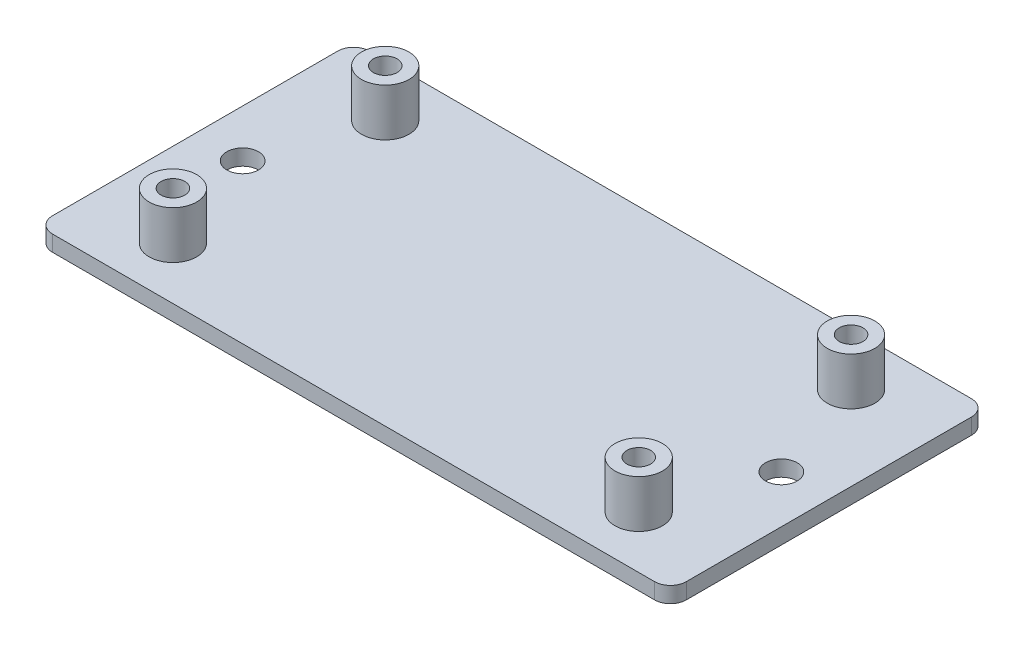
from build123d import *

# Parameters (mm, degrees)
SKETCH_1_W               = 80
SKETCH_1_H               = 40
EXTRUDE_1_DEPTH          = 2
SKETCH_2_R               = 3
EXTRUDE_2_DEPTH          = 6
CUT_EXTRUDE_1_DEPTH      = 90.799777283
CUT_EXTRUDE_1_DEPTH_BACK = 90.799777283
SKETCH_3_R               = 1.5
CUT_EXTRUDE_2_DEPTH      = 90.643739324
CUT_EXTRUDE_2_DEPTH_BACK = 90.643739324
SKETCH_4_R               = 2
FILLET_1_R               = 2
FILLET_2_R               = 2
FILLET_3_R               = 2
FILLET_4_R               = 2


with BuildPart() as part:
    # Эскиз1 → Бобышка-Вытянуть1 (new body)
    with BuildSketch(Plane(origin=(0, 0, 0), x_dir=(1, 0, 0), z_dir=(0, 1, 0))):
        with Locations((40, -20)):
            Rectangle(SKETCH_1_W, SKETCH_1_H)
    extrude(amount=EXTRUDE_1_DEPTH)

    # Эскиз2 → Бобышка-Вытянуть2 (add)
    with BuildSketch(Plane(origin=(0, 2, 0), x_dir=(1, 0, 0), z_dir=(0, 1, 0))):
        with Locations((10.6, -6.6)):
            Circle(SKETCH_2_R)
        with Locations((10.6, -33.4)):
            Circle(SKETCH_2_R)
        with Locations((69.4, -6.6)):
            Circle(SKETCH_2_R)
        with Locations((69.4, -33.4)):
            Circle(SKETCH_2_R)
    extrude(amount=EXTRUDE_2_DEPTH)

    # Эскиз3 → Вырез-Вытянуть1 (cut, two sides: drawn at the far end of the back side and taken through both)
    with BuildSketch(Plane(origin=(0, 8, 0), x_dir=(1, 0, 0), z_dir=(0, 1, 0)).offset(-CUT_EXTRUDE_1_DEPTH_BACK)):
        with Locations((10.6, -6.6)):
            Circle(SKETCH_3_R)
        with Locations((10.6, -33.4)):
            Circle(SKETCH_3_R)
        with Locations((69.4, -6.6)):
            Circle(SKETCH_3_R)
        with Locations((69.4, -33.4)):
            Circle(SKETCH_3_R)
    extrude(amount=CUT_EXTRUDE_1_DEPTH + CUT_EXTRUDE_1_DEPTH_BACK, mode=Mode.SUBTRACT)

    # Эскиз4 → Вырез-Вытянуть2 (cut, two sides: drawn at the far end of the back side and taken through both)
    with BuildSketch(Plane(origin=(0, 2, 0), x_dir=(1, 0, 0), z_dir=(0, 1, 0)).offset(-CUT_EXTRUDE_2_DEPTH_BACK)):
        with Locations((6, -20)):
            Circle(SKETCH_4_R)
        with Locations((74, -20)):
            Circle(SKETCH_4_R)
    extrude(amount=CUT_EXTRUDE_2_DEPTH + CUT_EXTRUDE_2_DEPTH_BACK, mode=Mode.SUBTRACT)

    # Скругление1
    fillet_1_edges = [part.edges().sort_by_distance(p)[0] for p in [
        (0, 1, 0),
    ]]
    fillet(fillet_1_edges, radius=FILLET_1_R)

    # Скругление2
    fillet_2_edges = [part.edges().sort_by_distance(p)[0] for p in [
        (0, 1, 40),
    ]]
    fillet(fillet_2_edges, radius=FILLET_2_R)

    # Скругление3
    fillet_3_edges = [part.edges().sort_by_distance(p)[0] for p in [
        (80, 1, 40),
    ]]
    fillet(fillet_3_edges, radius=FILLET_3_R)

    # Скругление4
    fillet_4_edges = [part.edges().sort_by_distance(p)[0] for p in [
        (80, 1, 0),
    ]]
    fillet(fillet_4_edges, radius=FILLET_4_R)


solid = part.part
